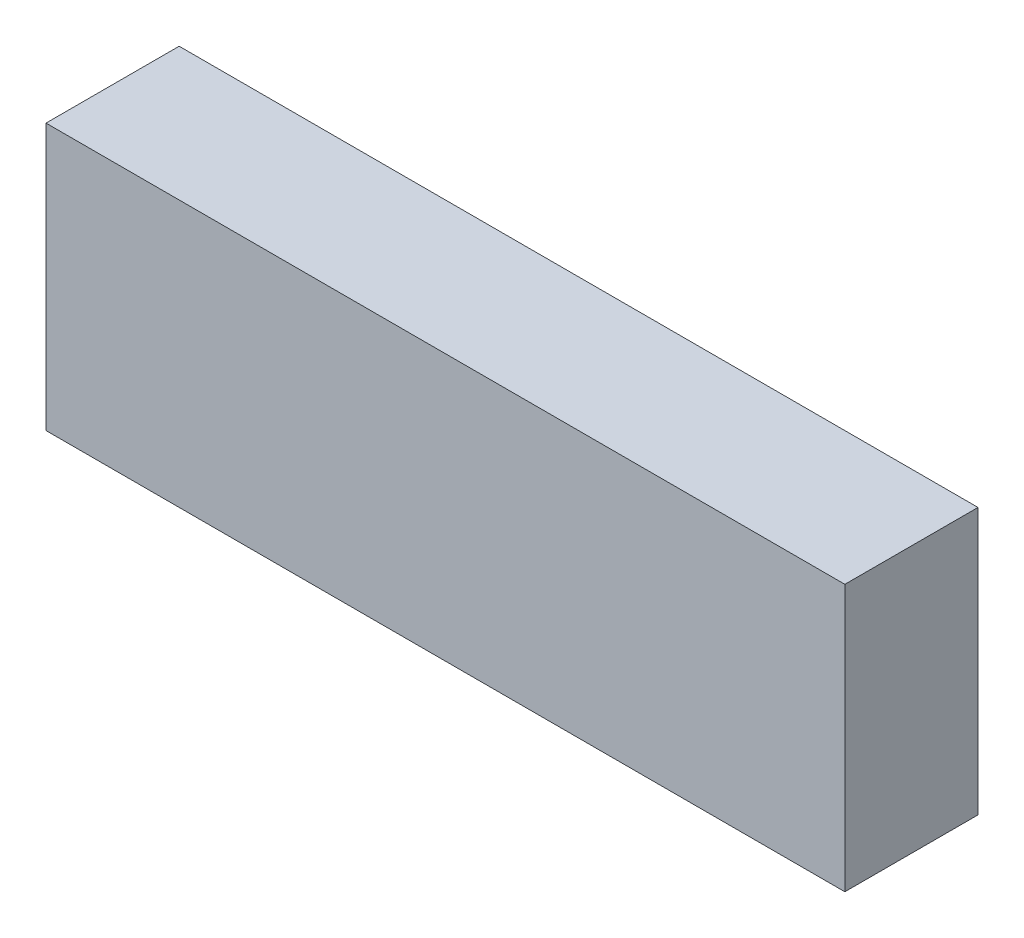
from build123d import *

# Parameters (mm, degrees)
SKETCH1_W           = 30
SKETCH1_H           = 5
BOSS_EXTRUDE1_DEPTH = 10


with BuildPart() as part:
    # Sketch1 → Boss-Extrude1 (new body)
    with BuildSketch(Plane(origin=(0, 0, 0), x_dir=(1, 0, 0), z_dir=(0, 1, 0))):
        Rectangle(SKETCH1_W, SKETCH1_H)
    extrude(amount=BOSS_EXTRUDE1_DEPTH)


solid = part.part
